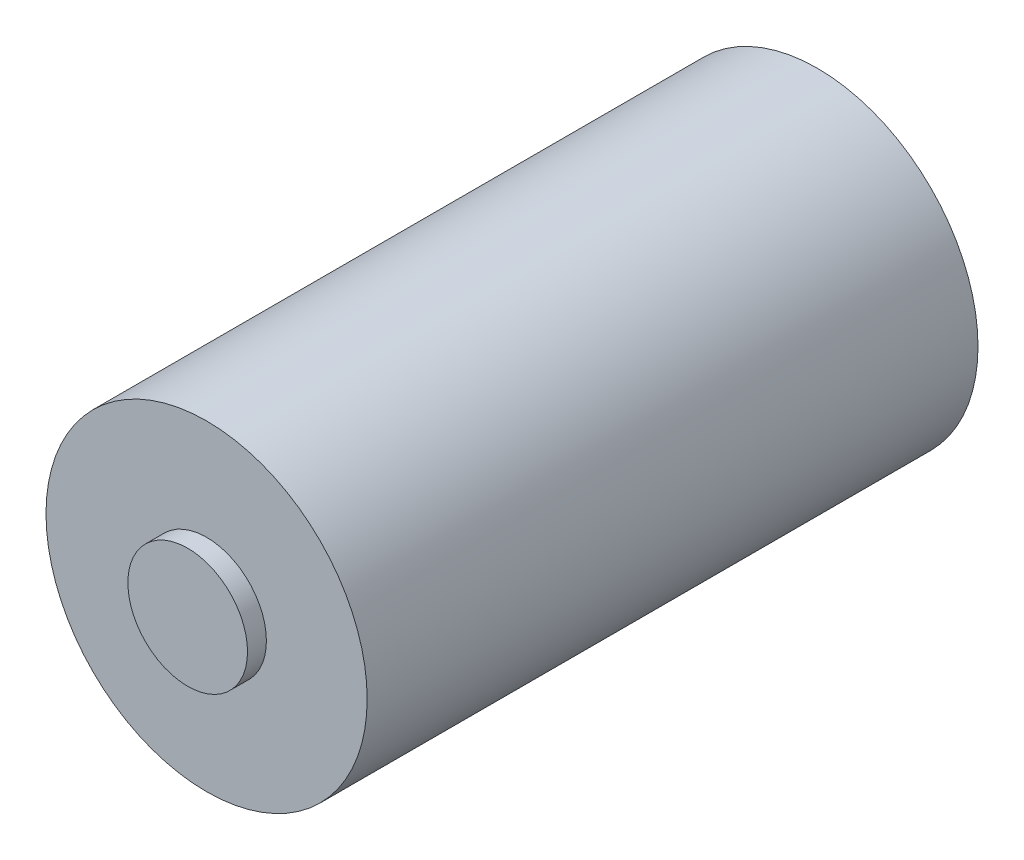
from build123d import *

# Parameters (mm, degrees)
ESQUISSE1_R             = 12.75
BOSS_EXTRU_1_DEPTH      = 50
ENL_V_START             = -1.5
ESQUISSE2_R             = 12.75
ESQUISSE2_R_2           = 4.75
ENL_V_MAT_EXTRU_1_DEPTH = 1.5


with BuildPart() as part:
    # Esquisse1 → Boss.-Extru.1 (new body)
    with BuildSketch(Plane.XY):
        Circle(ESQUISSE1_R)
    extrude(amount=BOSS_EXTRU_1_DEPTH)

    # Esquisse2 → Enlèv. mat.-Extru.1 (cut)
    with BuildSketch(Plane.XY.offset(50).offset(ENL_V_START)):
        Circle(ESQUISSE2_R)
        Circle(ESQUISSE2_R_2, mode=Mode.SUBTRACT)
    extrude(amount=ENL_V_MAT_EXTRU_1_DEPTH, mode=Mode.SUBTRACT)


solid = part.part
